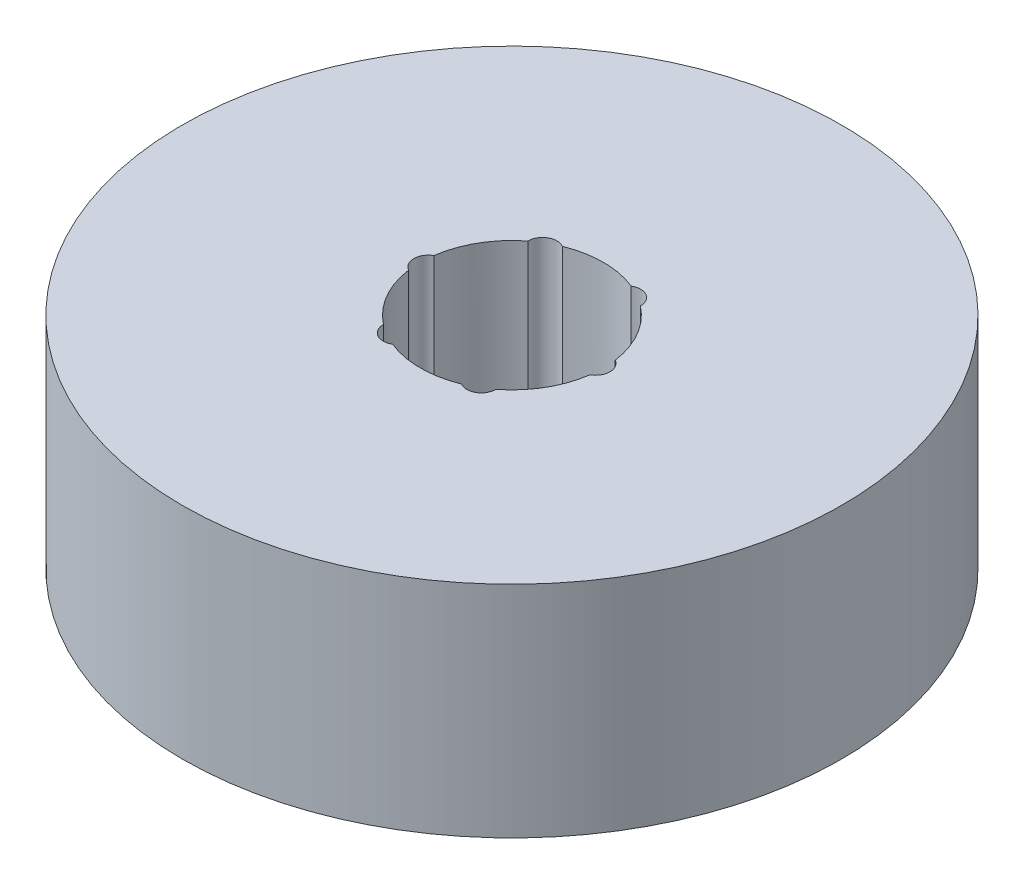
from build123d import *

# Parameters (mm, degrees)
SKETCH1_R           = 45
BOSS_EXTRUDE1_DEPTH = 30
SKETCH2_R           = 12.5
CUT_EXTRUDE1_DEPTH  = 71.356236397
SKETCH3_R           = 1.96863067
CUT_EXTRUDE2_DEPTH  = 23.765838206
CIRPATTERN1_COUNT   = 6


with BuildPart() as part:
    # Sketch1 → Boss-Extrude1 (new body)
    with BuildSketch(Plane(origin=(0, 0, 0), x_dir=(1, 0, 0), z_dir=(0, 1, 0))):
        Circle(SKETCH1_R)
    extrude(amount=BOSS_EXTRUDE1_DEPTH)

    # Sketch2 → Cut-Extrude1 (cut, through all)
    with BuildSketch(Plane(origin=(0, 0, 0), x_dir=(1, 0, 0), z_dir=(0, 1, 0))):
        Circle(SKETCH2_R)
    extrude(amount=CUT_EXTRUDE1_DEPTH, mode=Mode.SUBTRACT)

    # Sketch3 → Cut-Extrude2 (cut)
    with BuildSketch(Plane(origin=(0, 30, 0), x_dir=(1, 0, 0), z_dir=(0, 1, 0))):
        with Locations((-11.424425229, 0)):
            Circle(SKETCH3_R)
    cut_extrude2 = extrude(amount=-CUT_EXTRUDE2_DEPTH, mode=Mode.SUBTRACT)

    # CirPattern1: Cut-Extrude2 ×6 about axis
    cirpattern1_axis = Axis((0, 0, 0), (0, 1, 0))
    for i in range(1, CIRPATTERN1_COUNT):
        add(cut_extrude2.rotate(cirpattern1_axis, i * 360 / CIRPATTERN1_COUNT), mode=Mode.SUBTRACT)


solid = part.part
